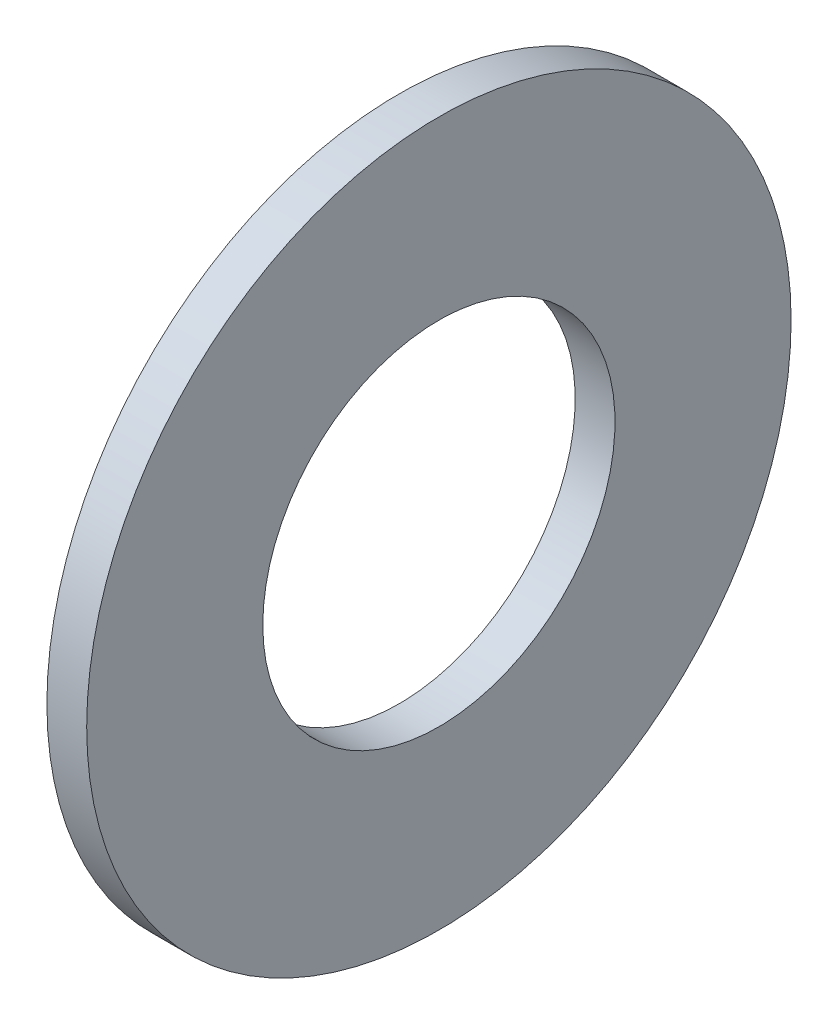
from build123d import *

# Parameters (mm, degrees)
SKETCH1_R           = 13.4874
SKETCH1_R_2         = 6.7437
BOSS_EXTRUDE2_DEPTH = 1.524


with BuildPart() as part:
    # Sketch1 → Boss-Extrude2 (new body)
    with BuildSketch(Plane(origin=(0, 0, 0), x_dir=(0, 0, -1), z_dir=(1, 0, 0))):
        Circle(SKETCH1_R)
        Circle(SKETCH1_R_2, mode=Mode.SUBTRACT)
    extrude(amount=BOSS_EXTRUDE2_DEPTH)


solid = part.part
